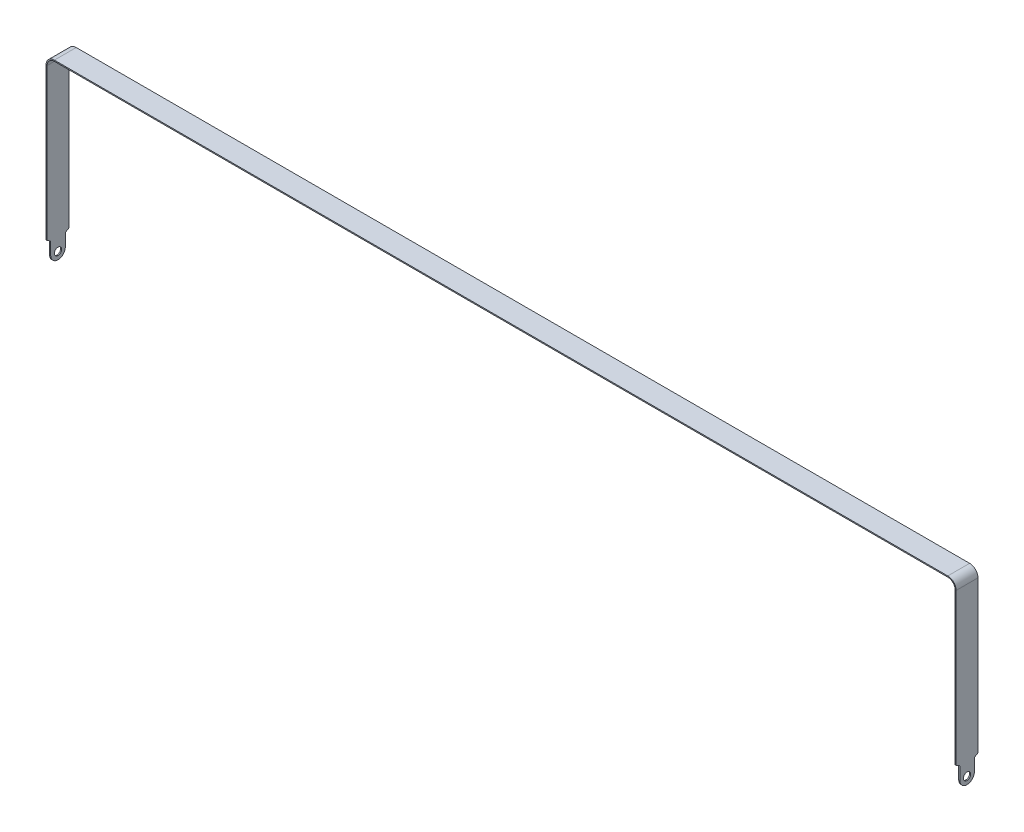
from build123d import *

# Parameters (mm, degrees)
SKETCH1_W                      = 623.5
SKETCH1_H                      = 15
BASE_FLANGE2_DEPTH             = 0.75
EDGE_FLANGE1_STRIP_W           = 13
EDGE_FLANGE1_STRIP_H           = 0.75
EDGE_FLANGE1_STRIP_CUT_DEPTH   = 15
EDGE_FLANGE1_STRIP_2_W         = 13
EDGE_FLANGE1_STRIP_2_H         = 0.75
EDGE_FLANGE1_STRIP_CUT_2_DEPTH = 15
EDGE_FLANGE1_DEPTH             = 15
EDGE_FLANGE1_BEND_DEPTH        = 15
SKETCH17_R                     = 2.5
CUT_EXTRUDE1_DEPTH             = 638.421563802


# Sheet-metal steps are written as plain solids
with BuildPart() as part:
    # Sketch1 → Base-Flange2 (new body)
    with BuildSketch(Plane(origin=(0, 0, 0), x_dir=(1, 0, 0), z_dir=(0, 1, 0))):
        Rectangle(SKETCH1_W, SKETCH1_H)
    extrude(amount=-BASE_FLANGE2_DEPTH)

    # Edge-Flange1 strip (across the edge) → Edge-Flange1 strip cut (cut)
    with BuildSketch(Plane(origin=(311.75, -0.75, -7.5), x_dir=(-1, 0, 0), z_dir=(0, 0, 1))):
        with Locations((-1.5, -0.375)):
            Rectangle(EDGE_FLANGE1_STRIP_W, EDGE_FLANGE1_STRIP_H)
    extrude(amount=EDGE_FLANGE1_STRIP_CUT_DEPTH, mode=Mode.SUBTRACT)

    # Edge-Flange1 strip 2 (across the edge) → Edge-Flange1 strip cut 2 (cut)
    with BuildSketch(Plane(origin=(-311.75, -0.75, 7.5), x_dir=(1, 0, 0), z_dir=(0, 0, -1))):
        with Locations((-1.5, -0.375)):
            Rectangle(EDGE_FLANGE1_STRIP_2_W, EDGE_FLANGE1_STRIP_2_H)
    extrude(amount=EDGE_FLANGE1_STRIP_CUT_2_DEPTH, mode=Mode.SUBTRACT)

    # Edge-Flange1 section (across the edge) → Edge-Flange1 (add)
    with BuildSketch(Plane(origin=(311.75, -0.75, -7.5), x_dir=(-1, 0, 0), z_dir=(0, 0, 1))):
        with BuildLine():
            Line((-0.75, 5), (-0.75, 124.25))
            Line((-0.75, 124.25), (0, 124.25))
            Line((0, 124.25), (0, 5))
            ThreePointArc((0, 5), (1.464466094, 1.464466094), (5, 0))
            Line((5, 0), (5, -0.75))
            ThreePointArc((5, -0.75), (0.934136008, 0.934136008), (-0.75, 5))
        make_face()
    extrude(amount=EDGE_FLANGE1_DEPTH)

    # Edge-Flange1 section 2 (across the edge) → Edge-Flange1 bend (add)
    with BuildSketch(Plane(origin=(-311.75, -0.75, 7.5), x_dir=(1, 0, 0), z_dir=(0, 0, -1))):
        with BuildLine():
            Line((-0.75, 5), (-0.75, 124.25))
            Line((-0.75, 124.25), (0, 124.25))
            Line((0, 124.25), (0, 5))
            ThreePointArc((0, 5), (1.464466094, 1.464466094), (5, 0))
            Line((5, 0), (5, -0.75))
            ThreePointArc((5, -0.75), (0.934136008, 0.934136008), (-0.75, 5))
        make_face()
    extrude(amount=EDGE_FLANGE1_BEND_DEPTH)

    # Sketch17 → Cut-Extrude1 (cut, through all)
    with BuildSketch(Plane(origin=(312.5, 0, 0), x_dir=(0, 0, -1), z_dir=(1, 0, 0))):
        with Locations(Location((0, -120, 0), (0, 0, 90))):
            Circle(SKETCH17_R)
        with BuildLine():
            Line((-5, -111.286267084), (-5, -120))
            ThreePointArc((-5, -120), (0, -125), (5, -120))
            Line((5, -120), (5, -111.286267084))
            Line((5, -111.286267084), (9.961082892, -108.386663731))
            Line((9.961082892, -108.386663731), (9.961082892, -134.171353008))
            Line((9.961082892, -134.171353008), (-9.961082892, -134.171353008))
            Line((-9.961082892, -134.171353008), (-9.961082892, -108.386663731))
            Line((-9.961082892, -108.386663731), (-5, -111.286267084))
        make_face()
    extrude(amount=-CUT_EXTRUDE1_DEPTH, mode=Mode.SUBTRACT)


solid = part.part
